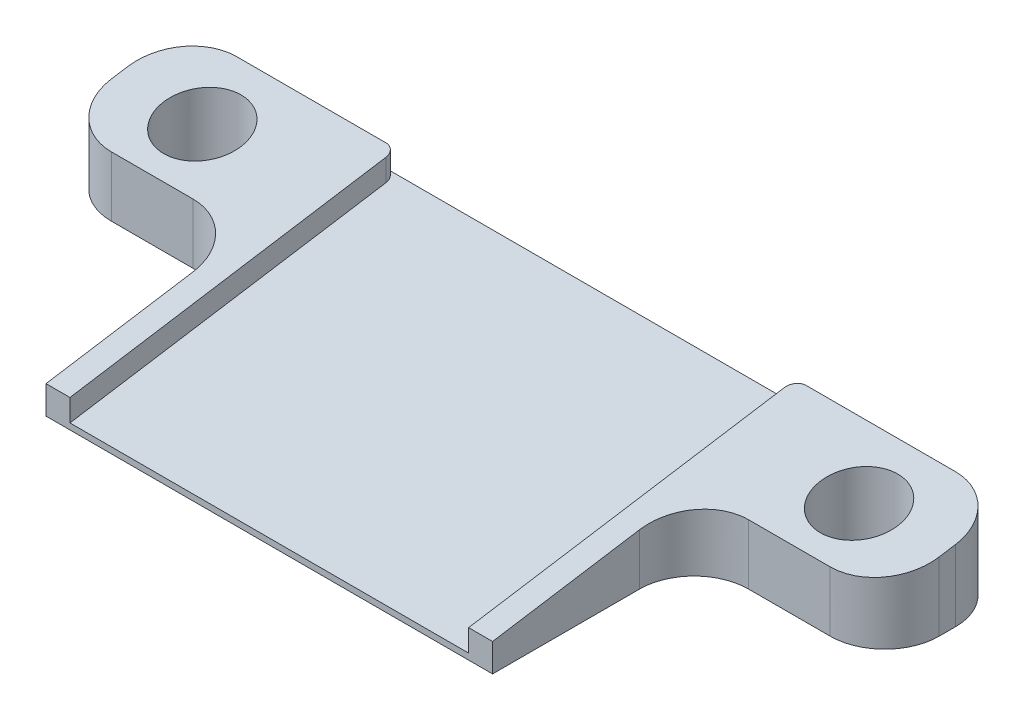
from build123d import *

# Parameters (mm, degrees)
SKETCH1_R           = 3.55
BOSS_EXTRUDE1_DEPTH = 10
CUT_EXTRUDE1_DEPTH  = 81.944425379
SKETCH3_W           = 17.5
SKETCH3_H           = 28.5
CUT_EXTRUDE2_DEPTH  = 47.624111409
SKETCH4_W           = 36.6
SKETCH4_H           = 45.032734813
CUT_EXTRUDE3_DEPTH  = 2
FILLET1_R           = 5
FILLET2_R           = 1
SKETCH7_W           = 10
SKETCH7_H           = 8
CUT_EXTRUDE4_DEPTH  = 65.436463006


with BuildPart() as part:
    # Sketch1 → Boss-Extrude1 (new body)
    with BuildSketch(Plane(origin=(0, 0, 0), x_dir=(1, 0, 0), z_dir=(0, 1, 0))):
        Polygon((38, 26), (0, 26), (-38, 26), (-38, -14), (38, -14), align=None)
        with Locations((-30.15, 20)):
            Circle(SKETCH1_R, mode=Mode.SUBTRACT)
        with BuildLine():
            ThreePointArc((33.7, 20), (30.15, 16.45), (26.6, 20))
            ThreePointArc((26.6, 20), (30.15, 23.55), (33.7, 20))
        make_face(mode=Mode.SUBTRACT)
    extrude(amount=BOSS_EXTRUDE1_DEPTH)

    # Sketch2 → Cut-Extrude1 (cut, through all)
    with BuildSketch(Plane(origin=(38, 0, 0), x_dir=(0, 0, -1), z_dir=(1, 0, 0))):
        Polygon((-14, 10), (-14, 1), (26, 7.335377613), (26, 10), align=None)
    extrude(amount=-CUT_EXTRUDE1_DEPTH, mode=Mode.SUBTRACT)

    # Sketch3 → Cut-Extrude2 (cut, through all)
    with BuildSketch(Plane.XZ):
        with Locations((-29.25, -0.25)):
            Rectangle(SKETCH3_W, SKETCH3_H)
        with Locations((29.25, -0.25)):
            Rectangle(SKETCH3_W, SKETCH3_H)
    extrude(amount=-CUT_EXTRUDE2_DEPTH, mode=Mode.SUBTRACT)

    # Sketch4 → Cut-Extrude3 (cut)
    with BuildSketch(Plane(origin=(0, 3.138647219, 0.497112883), x_dir=(1, 0, 0), z_dir=(0, 0.9876883405951378, 0.1564344650402312))):
        with Locations((0, 4.311035322)):
            Rectangle(SKETCH4_W, SKETCH4_H)
    extrude(amount=-CUT_EXTRUDE3_DEPTH, mode=Mode.SUBTRACT)

    # Fillet1
    fillet1_edges = [part.edges().sort_by_distance(p)[0] for p in [
        (38, 2.756978275, -14.5),
        (38, 3.667688806, -26),
        (20.5, 2.756978275, -14.5),
        (-38, 3.667688806, -26),
        (-38, 2.756978275, -14.5),
        (-20.5, 2.756978275, -14.5),
    ]]
    fillet(fillet1_edges, radius=FILLET1_R)

    # Fillet2
    fillet2_edges = [part.edges().sort_by_distance(p)[0] for p in [
        (18.3, 6.322912487, -26),
        (-18.3, 6.322912487, -26),
    ]]
    fillet(fillet2_edges, radius=FILLET2_R)

    # Sketch7 → Cut-Extrude4 (cut, through all)
    with BuildSketch(Plane(origin=(20.5, 0, 0), x_dir=(0, 0, -1), z_dir=(1, 0, 0))):
        with Locations((-9, 4)):
            Rectangle(SKETCH7_W, SKETCH7_H)
    extrude(amount=-CUT_EXTRUDE4_DEPTH, mode=Mode.SUBTRACT)


solid = part.part
